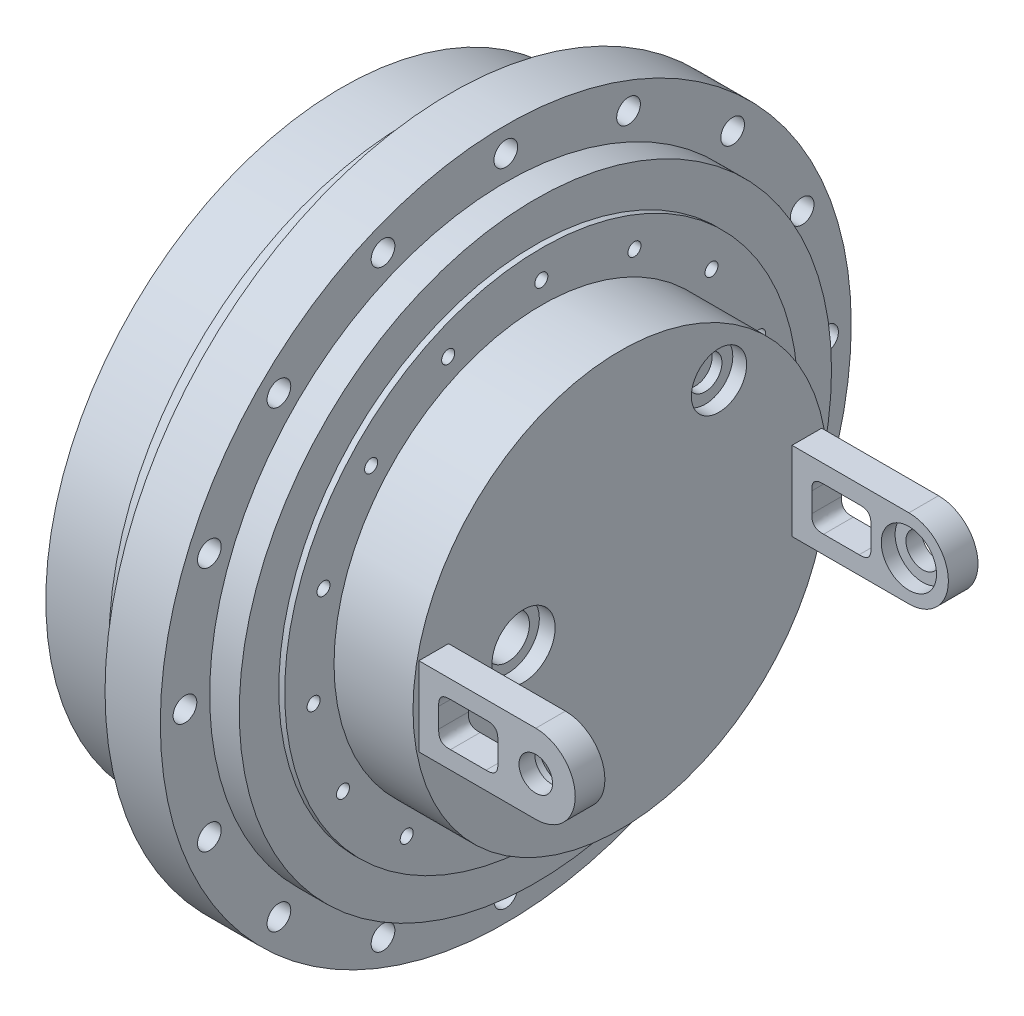
from build123d import *

# Parameters (mm, degrees)
SKETCH1_W           = 40
SKETCH1_H           = 105
CIRPATTERN1_COUNT   = 16
CUT_EXTRUDE1_DEPTH  = 0.5
SKETCH6_R           = 8.5
CUT_EXTRUDE2_DEPTH  = 25
CIRPATTERN2_COUNT   = 4
CIRPATTERN3_COUNT   = 15
FILLET1_START       = 19.75
FILLET1_DEPTH       = 7.25
SKETCH13_R          = 8.5
BOSS_EXTRUDE1_DEPTH = 15
CUT_EXTRUDE3_REACH  = 369.731
SKETCH14_W          = 30
SKETCH14_H          = 22
FILLET2_START       = 87
FILLET2_OUTLINE_W   = 33
FILLET2_OUTLINE_H   = 26
FILLET2_DEPTH       = 15
SKETCH16_R          = 14
CUT_EXTRUDE4_DEPTH  = 7
SKETCH17_R          = 14
CUT_EXTRUDE5_DEPTH  = 7
SKETCH19_R          = 8.5
CUT_EXTRUDE6_DEPTH  = 5


with BuildPart() as part:
    # Sketch1 → Revolve1 (revolve)
    with BuildSketch(Plane.XY, mode=Mode.PRIVATE) as revolve1_sk:
        Polygon((1.75, 153), (-18.25, 153), (-18.25, 150), (-53.25, 150), (-53.25, 128.5), (-58.25, 128.5), (-58.25, 90), (-53.75, 90), (-53.75, 27.5), (-44.75, 27.5), (-44.75, 0), (44.75, 0), (44.75, 150), (29.75, 150), (29.75, 175), (1.75, 175), align=None)
        Polygon((44.75, 130), (44.75, 0), (47.75, 0), (47.75, 105), (47.75, 130), align=None)
        with Locations((67.75, 52.5)):
            Rectangle(SKETCH1_W, SKETCH1_H)
    revolve(revolve1_sk.sketch.rotate(Axis((44.75, 0, 0), (-1, 0, 0)), 90), axis=Axis((44.75, 0, 0), (-1, 0, 0)))

    # Sketch4 → Ø12.0mm Dowel Hole1 (revolve, cut)
    with BuildSketch(Plane(origin=(29.75, 162.5, 0), x_dir=(0, 0, -1), z_dir=(0, 1, 0))):
        Polygon((0, 0), (0, 23.605163714), (6, 20), (6, 0), align=None)
    f_12_0mm_dowel_hole1 = revolve(axis=Axis((36.1, 162.5, 0), (-1, 0, 0)), mode=Mode.SUBTRACT)

    # CirPattern1: Ø12.0mm Dowel Hole1 ×16 about axis
    cirpattern1_axis = Axis((0, 0, 0), (1, 0, 0))
    for i in range(1, CIRPATTERN1_COUNT):
        add(f_12_0mm_dowel_hole1.rotate(cirpattern1_axis, i * 360 / CIRPATTERN1_COUNT), mode=Mode.SUBTRACT)

    # Sketch5 → Cut-Extrude1 (cut)
    with BuildSketch(Plane.ZY.offset(58.25)):
        with BuildLine():
            Line((80, -95), (-80, -95))
            ThreePointArc((-80, -95), (-90.606601718, -90.606601718), (-95, -80))
            Line((-95, -80), (-95, 80))
            ThreePointArc((-95, 80), (-90.606601718, 90.606601718), (-80, 95))
            Line((-80, 95), (80, 95))
            ThreePointArc((80, 95), (90.606601718, 90.606601718), (95, 80))
            Line((95, 80), (95, -80))
            ThreePointArc((95, -80), (90.606601718, -90.606601718), (80, -95))
        make_face()
    extrude(amount=-CUT_EXTRUDE1_DEPTH, mode=Mode.SUBTRACT)

    # Sketch6 → Cut-Extrude2 (cut)
    with BuildSketch(Plane.ZY.offset(57.75)):
        with Locations((74.953318806, 74.953318806)):
            Circle(SKETCH6_R)
    cut_extrude2 = extrude(amount=-CUT_EXTRUDE2_DEPTH, mode=Mode.SUBTRACT)

    # CirPattern2: Cut-Extrude2 ×4 about axis
    cirpattern2_axis = Axis((0, 0, 0), (1, 0, 0))
    for i in range(1, CIRPATTERN2_COUNT):
        add(cut_extrude2.rotate(cirpattern2_axis, i * 360 / CIRPATTERN2_COUNT), mode=Mode.SUBTRACT)

    # Sketch8 → Ø6.0mm Dowel Hole1 (revolve, cut)
    with BuildSketch(Plane(origin=(47.75, 116, 0), x_dir=(0, 0, -1), z_dir=(0, 1, 0))):
        Polygon((0, 0), (0, 21.982840043), (3.3, 20), (3.3, 0), align=None)
    f_6_0mm_dowel_hole1 = revolve(axis=Axis((54.1, 116, 0), (-1, 0, 0)), mode=Mode.SUBTRACT)

    # CirPattern3: Ø6.0mm Dowel Hole1 ×15 about axis
    cirpattern3_axis = Axis((0, 0, 0), (1, 0, 0))
    for i in range(1, CIRPATTERN3_COUNT):
        add(f_6_0mm_dowel_hole1.rotate(cirpattern3_axis, i * 360 / CIRPATTERN3_COUNT), mode=Mode.SUBTRACT)

    # Sketch9 → Cut-Revolve2 (revolve, cut)
    with BuildSketch(Plane.XY, mode=Mode.PRIVATE) as cut_revolve2_sk:
        Polygon((-53.25, 0), (49.75, 0), (49.75, 40), (19.75, 40), (19.75, 21), (9.75, 21), (9.75, 23.5), (-4.25, 23.5), (-4.25, 17.5), (-10.25, 17.5), (-10.25, 16), (-53.25, 16), align=None)
    revolve(cut_revolve2_sk.sketch.rotate(Axis((-53.25, 0, 0), (1, 0, 0)), 90), axis=Axis((-53.25, 0, 0), (1, 0, 0)), mode=Mode.SUBTRACT)

    # Sketch11 → Cut-Revolve3 (revolve, cut)
    with BuildSketch(Plane.XY.offset(49)):
        Polygon((-0.75, 16), (6.25, 16), (6.25, 11), (26.25, 11), (26.25, 25), (56.25, 25), (56.25, 11), (79.75, 11), (79.75, 16), (87.75, 16), (87.75, 0), (-0.75, 0), align=None)
    revolve(axis=Axis((87.75, 0, 49), (-1, 0, 0)), mode=Mode.SUBTRACT)

    # Fillet1: read off the stored shape, not the designer's step
    # Fillet1 outline → Fillet1 (cut)
    with BuildSketch(Plane.YZ.offset(FILLET1_START)):
        with BuildLine():
            ThreePointArc((-5.699689814, 39.591836735), (-9.100186769, 42.820469211), (-10.847048384, 47.172011662))
            add(Edge.make_bspline(
                [(-10.847048384, 47.172011662), (-10.692460731, 46.254708358), (-10.393838578, 45.07445434), (-10.207497502, 41.498011322), (-11.700042314, 39.042285638), (-14.285979612, 37.396176354), (-15.472144602, 36.906070647), (-16.566401168, 36.408163265)],
                knots=[0, 0, 0, 0, 0, 0, 0.5, 0.5, 1, 1, 1, 1, 1, 1], degree=5))
            ThreePointArc((-16.566401168, 36.408163265), (-11.246272542, 38.38647358), (-5.699689814, 39.591836735))
        make_face()
        with BuildLine():
            ThreePointArc((5.699689814, 39.591836735), (11.246272542, 38.38647358), (16.566401168, 36.408163266))
            add(Edge.make_bspline(
                [(10.847048384, 47.172011662), (10.692460731, 46.254708358), (10.393838578, 45.07445434), (10.207497502, 41.498011322), (11.700042314, 39.042285638), (14.285979612, 37.396176354), (15.472144602, 36.906070647), (16.566401168, 36.408163266)],
                knots=[0, 0, 0, 0, 0, 0, 0.5, 0.5, 1, 1, 1, 1, 1, 1], degree=5))
            ThreePointArc((10.847048384, 47.172011662), (9.100186769, 42.820469211), (5.699689814, 39.591836735))
        make_face()
    extrude(amount=FILLET1_DEPTH, mode=Mode.SUBTRACT)

    # Sketch13 → Boss-Extrude1 (add)
    with BuildSketch(Plane.XY.offset(87)):
        with BuildLine():
            Line((87.75, 20), (146.95, 20))
            ThreePointArc((146.95, 20), (166.95, 0), (146.95, -20))
            Line((146.95, -20), (87.75, -20))
            Line((87.75, -20), (87.75, 20))
        make_face()
        with Locations((146.95, 0)):
            Circle(SKETCH13_R, mode=Mode.SUBTRACT)
    boss_extrude1 = extrude(amount=BOSS_EXTRUDE1_DEPTH)

    # Sketch14 → Cut-Extrude3 (cut, up to next)
    with BuildSketch(Plane.XY.offset(102), mode=Mode.PRIVATE) as cut_extrude3_sk1:
        with Locations((112.75, 0)):
            Rectangle(SKETCH14_W, SKETCH14_H)
    cut_extrude3_tool1 = extrude(cut_extrude3_sk1.sketch, amount=-CUT_EXTRUDE3_REACH, mode=Mode.PRIVATE) & part.part
    cut_extrude3 = cut_extrude3_tool1.solids().sort_by_distance((112.75, 0, 102))[0]
    add(cut_extrude3, mode=Mode.SUBTRACT)

    # Fillet2: read off the stored shape, not the designer's step
    # Fillet2 outline → Fillet2 (add)
    with BuildSketch(Plane.XY.offset(FILLET2_START)):
        with Locations((112.5, 0)):
            Rectangle(FILLET2_OUTLINE_W, FILLET2_OUTLINE_H)
        with BuildLine():
            add(Edge.make_bspline(
                [(97.75, -5), (97.75, -6.009188309), (97.75, -7.018376618), (98.180151519, -9.242640687), (99.507359313, -10.569848481), (101.731623382, -11), (102.740811691, -11), (103.75, -11)],
                knots=[0, 0, 0, 0, 0, 0, 0.5, 0.5, 1, 1, 1, 1, 1, 1], degree=5))
            Line((97.75, -5), (97.75, 5))
            add(Edge.make_bspline(
                [(103.75, 11), (102.740811691, 11), (101.731623382, 11), (99.507359313, 10.569848481), (98.180151519, 9.242640687), (97.75, 7.018376618), (97.75, 6.009188309), (97.75, 5)],
                knots=[0, 0, 0, 0, 0, 0, 0.5, 0.5, 1, 1, 1, 1, 1, 1], degree=5))
            Line((103.75, 11), (121.75, 11))
            add(Edge.make_bspline(
                [(127.75, 5), (127.75, 6.009188309), (127.75, 7.018376618), (127.319848481, 9.242640687), (125.992640687, 10.569848481), (123.768376618, 11), (122.759188309, 11), (121.75, 11)],
                knots=[0, 0, 0, 0, 0, 0, 0.5, 0.5, 1, 1, 1, 1, 1, 1], degree=5))
            Line((127.75, 5), (127.75, -5))
            add(Edge.make_bspline(
                [(121.75, -11), (122.759188309, -11), (123.768376618, -11), (125.992640687, -10.569848481), (127.319848481, -9.242640687), (127.75, -7.018376618), (127.75, -6.009188309), (127.75, -5)],
                knots=[0, 0, 0, 0, 0, 0, 0.5, 0.5, 1, 1, 1, 1, 1, 1], degree=5))
            Line((121.75, -11), (103.75, -11))
        make_face(mode=Mode.SUBTRACT)
    fillet2 = extrude(amount=FILLET2_DEPTH)

    # Sketch16 → Cut-Extrude4 (cut)
    with BuildSketch(Plane(origin=(0, 0, 87), x_dir=(-1, 0, 0), z_dir=(0, 0, -1))):
        with Locations((-146.95, 0)):
            Circle(SKETCH16_R)
    cut_extrude4 = extrude(amount=-CUT_EXTRUDE4_DEPTH, mode=Mode.SUBTRACT)

    # Mirror1: Boss-Extrude1, Cut-Extrude3, Fillet2, Cut-Extrude4 across plane
    add(boss_extrude1.mirror(Plane.XY))
    add(cut_extrude3.mirror(Plane.XY), mode=Mode.SUBTRACT)
    add(fillet2.mirror(Plane.XY))
    add(cut_extrude4.mirror(Plane.XY), mode=Mode.SUBTRACT)

    # Sketch17 → Cut-Extrude5 (cut)
    with BuildSketch(Plane(origin=(87.75, 0, 0), x_dir=(0, 0, -1), z_dir=(1, 0, 0))):
        with Locations((50, 67)):
            Circle(SKETCH17_R)
    extrude(amount=-CUT_EXTRUDE5_DEPTH, mode=Mode.SUBTRACT)

    # Sketch19 → Cut-Extrude6 (cut)
    with BuildSketch(Plane(origin=(80.75, 0, 0), x_dir=(0, 0, -1), z_dir=(1, 0, 0))):
        with Locations((50, 67)):
            Circle(SKETCH19_R)
    extrude(amount=-CUT_EXTRUDE6_DEPTH, mode=Mode.SUBTRACT)


solid = part.part
